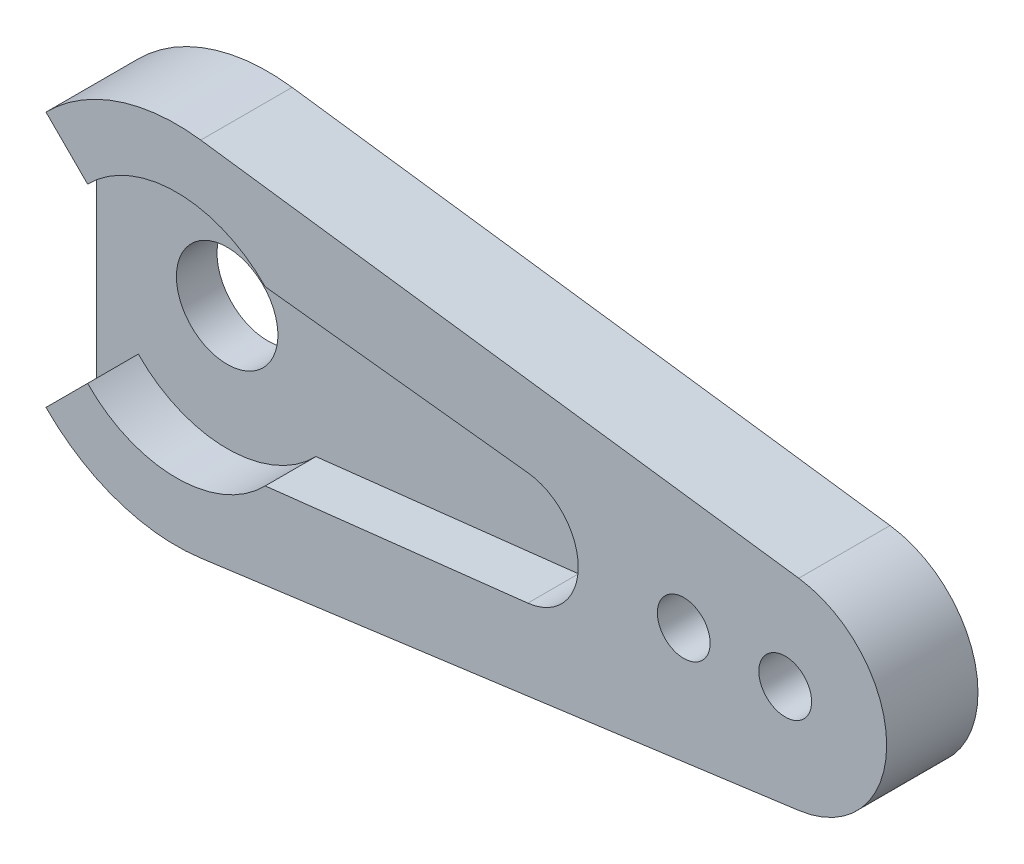
from build123d import *

# Parameters (mm, degrees)
MAIN_DEPTH            = 2.5
ORIGINALBRACKET_START = 2
ESQUISSE2_R           = 2.5
ORIGINALBRACKET_DEPTH = 2
ESQUISSE3_R           = 1.3
FIXINGHOLE_DEPTH      = 37.417715469


with BuildPart() as part:
    # Esquisse1 → Main (new body)
    with BuildSketch(Plane.XY):
        with BuildLine():
            Line((-4.375785644, 4.25), (-6.426543071, 6.300757427))
            ThreePointArc((-6.426543071, 6.300757427), (-2.922982421, 8.512119229), (1.2, 8.919641248))
            Line((1.2, 8.919641248), (30.666666667, 4.955356249))
            ThreePointArc((30.666666667, 4.955356249), (35, 0), (30.666666667, -4.955356249))
            Line((30.666666667, -4.955356249), (1.2, -8.919641248))
            ThreePointArc((1.2, -8.919641248), (-2.922982421, -8.512119229), (-6.426543071, -6.300757427))
            Line((-6.426543071, -6.300757427), (-4.375785644, -4.25))
            ThreePointArc((-4.375785644, -4.25), (0, -6.1), (4.375785644, -4.25))
            Line((4.375785644, -4.25), (17.31559729, -2.78215714))
            ThreePointArc((17.31559729, -2.78215714), (19.8, 0), (17.31559729, 2.78215714))
            Line((17.31559729, 2.78215714), (4.375785644, 4.25))
            ThreePointArc((4.375785644, 4.25), (0, 6.1), (-4.375785644, 4.25))
        make_face()
    extrude(amount=MAIN_DEPTH)

    # Esquisse2 → OriginalBracket (add)
    with BuildSketch(Plane(origin=(0, 0, 0), x_dir=(-1, 0, 0), z_dir=(0, 0, -1)).offset(ORIGINALBRACKET_START)):
        with BuildLine():
            Line((-1.2, -8.919641248), (-30.666666667, -4.955356249))
            ThreePointArc((-30.666666667, -4.955356249), (-35, 0), (-30.666666667, 4.955356249))
            Line((-30.666666667, 4.955356249), (-1.2, 8.919641248))
            ThreePointArc((-1.2, 8.919641248), (2.922982421, 8.512119229), (6.426543071, 6.300757427))
            Line((6.426543071, 6.300757427), (6.426543071, -6.300757427))
            ThreePointArc((6.426543071, -6.300757427), (2.922982421, -8.512119229), (-1.2, -8.919641248))
        make_face()
        Circle(ESQUISSE2_R, mode=Mode.SUBTRACT)
    extrude(amount=-ORIGINALBRACKET_DEPTH)

    # Esquisse3 → FixingHole (cut, through all)
    with BuildSketch(Plane.XY.offset(2.5)):
        with Locations((30, 0)):
            Circle(ESQUISSE3_R)
        with Locations((25, 0)):
            Circle(ESQUISSE3_R)
    extrude(amount=-FIXINGHOLE_DEPTH, mode=Mode.SUBTRACT)


solid = part.part
